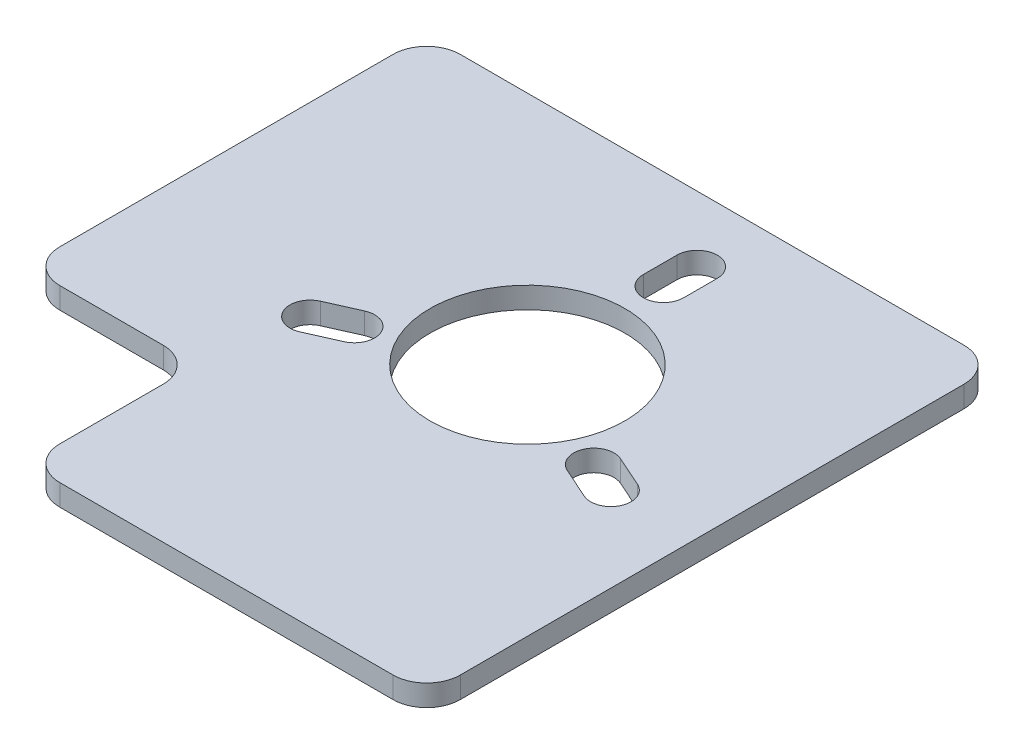
from build123d import *

# Parameters (mm, degrees)
SKETCH1_W           = 170
SKETCH1_H           = 170
SKETCH1_R           = 29
BOSS_EXTRUDE1_DEPTH = 6.35
SKETCH2_W           = 50.8
SKETCH2_H           = 50.8
CUT_EXTRUDE1_DEPTH  = 241.500150728
FILLET1_R           = 10
CUT_EXTRUDE2_DEPTH  = 241.500150728


with BuildPart() as part:
    # Sketch1 → Boss-Extrude1 (new body)
    with BuildSketch(Plane(origin=(0, 0, 0), x_dir=(1, 0, 0), z_dir=(0, 1, 0))):
        with Locations((85, 85)):
            Rectangle(SKETCH1_W, SKETCH1_H)
        with Locations((100, 100)):
            Circle(SKETCH1_R, mode=Mode.SUBTRACT)
    extrude(amount=BOSS_EXTRUDE1_DEPTH)

    # Sketch2 → Cut-Extrude1 (cut, through all)
    with BuildSketch(Plane(origin=(0, 6.35, 0), x_dir=(1, 0, 0), z_dir=(0, 1, 0))):
        with Locations((25.4, 25.4)):
            Rectangle(SKETCH2_W, SKETCH2_H)
    extrude(amount=-CUT_EXTRUDE1_DEPTH, mode=Mode.SUBTRACT)

    # Fillet1
    fillet1_edges = [part.edges().sort_by_distance(p)[0] for p in [
        (170, 3.175, -170),
        (170, 3.175, 0),
        (0, 3.175, -170),
        (50.8, 3.175, -50.8),
        (50.8, 3.175, 0),
        (0, 3.175, -50.8),
    ]]
    fillet(fillet1_edges, radius=FILLET1_R)

    # Sketch3 → Cut-Extrude2 (cut, through all)
    with BuildSketch(Plane(origin=(0, 6.35, 0), x_dir=(1, 0, 0), z_dir=(0, 1, 0))):
        with BuildLine():
            Line((106, 150.5), (106, 140.5))
            ThreePointArc((106, 140.5), (100, 134.5), (94, 140.5))
            Line((94, 140.5), (94, 150.5))
            ThreePointArc((94, 150.5), (100, 156.5), (106, 150.5))
        make_face()
        with BuildLine():
            Line((52.795852717, 85.551177235), (61.931307293, 89.618543666))
            ThreePointArc((61.931307293, 89.618543666), (69.852999898, 86.577690778), (66.81214701, 78.655998174))
            Line((66.81214701, 78.655998174), (57.676692434, 74.588631743))
            ThreePointArc((57.676692434, 74.588631743), (49.75499983, 77.629484631), (52.795852717, 85.551177235))
        make_face()
        with BuildLine():
            Line((142.323307566, 74.588631743), (133.18785299, 78.655998174))
            ThreePointArc((133.18785299, 78.655998174), (130.147000102, 86.577690778), (138.068692707, 89.618543666))
            Line((138.068692707, 89.618543666), (147.204147283, 85.551177235))
            ThreePointArc((147.204147283, 85.551177235), (150.24500017, 77.629484631), (142.323307566, 74.588631743))
        make_face()
    extrude(amount=-CUT_EXTRUDE2_DEPTH, mode=Mode.SUBTRACT)


solid = part.part
